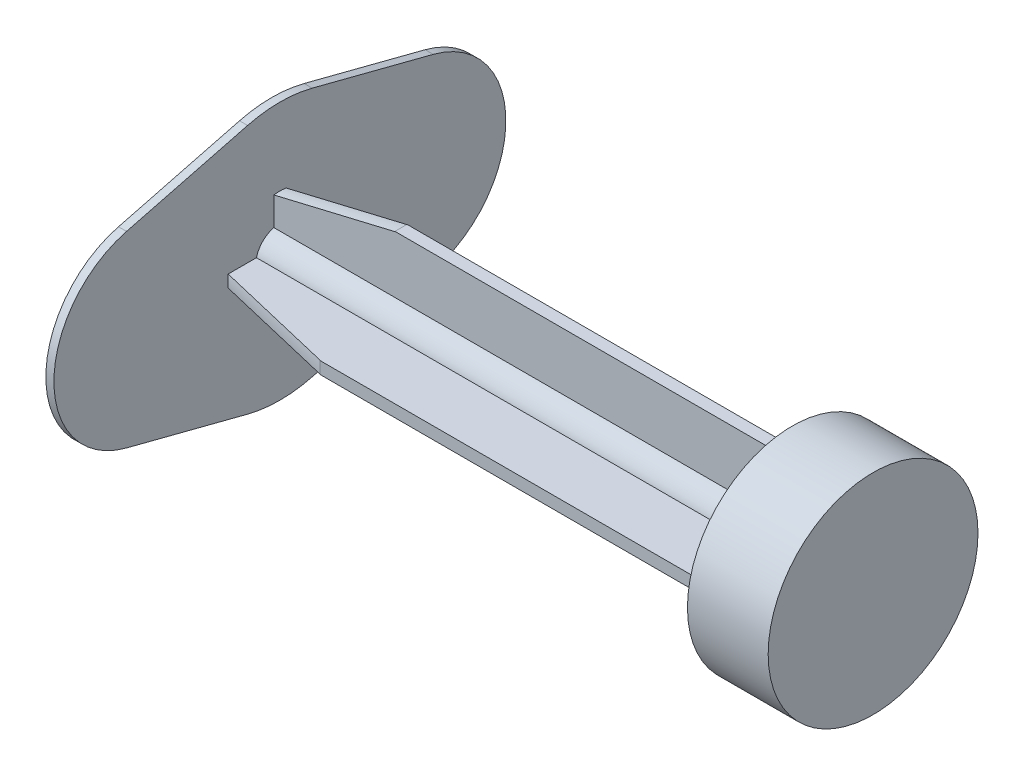
from build123d import *

# Parameters (mm, degrees)
BOSS_EXTRUDE1_DEPTH      = 90
FILLET1_R                = 7.5
FILLET2_R                = 2
SKETCH2_W                = 20
SKETCH2_H                = 80
SKETCH2_W_2              = 32
BOSS_EXTRUDE2_DEPTH      = 20
SKETCH3_R                = 2.5
BOSS_EXTRUDE3_DEPTH      = 111
BOSS_EXTRUDE4_START      = 7.5
SKETCH4_W                = 80
SKETCH4_H                = 20
SKETCH4_R                = 3.25
BOSS_EXTRUDE4_DEPTH      = 20
MOVE_FACE1_BY            = 1.5
MOVE_FACE2_BY            = 1.5
FILLET3_R                = 4
FILLET4_R                = 4
CUT_EXTRUDE1_DEPTH       = 2
BOSS_EXTRUDE5_DEPTH      = 2
SKETCH7_W                = 58
SKETCH7_H                = 15
CUT_EXTRUDE2_DEPTH       = 0.5
SKETCH8_R                = 10
BOSS_EXTRUDE6_DEPTH      = 1.5
SKETCH10_R               = 4.25
SKETCH10_R_2             = 2.75
CUT_EXTRUDE_THIN1_DEPTH  = 1.5
SKETCH11_RX              = 5
SKETCH11_RY              = 2.5
BOSS_EXTRUDE7_DEPTH      = 1.5
LPATTERN1_COUNT          = 3
LPATTERN1_PITCH          = 24
SKETCH12_RX              = 5
SKETCH12_RY              = 2.5
BOSS_EXTRUDE8_DEPTH      = 1.5
LPATTERN2_START          = 113.13708499
LPATTERN2_DEPTH          = 1.5
FILLET7_R                = 7.5
FILLET5_R                = 5
FILLET6_R                = 2
SHELL1_T                 = -1
SKETCH14_R               = 14
BOSS_EXTRUDE9_DEPTH      = 1
BOSS_EXTRUDE10_DEPTH     = 1
BOSS_EXTRUDE11_START     = -30
BOSS_EXTRUDE11_OUTLINE_R = 13
BOSS_EXTRUDE11_DEPTH     = 10
BOSS_EXTRUDE12_REACH     = 233.484
SKETCH18_R               = 3
SKETCH17_W               = 1.5
SKETCH17_H               = 20
SKETCH17_W_2             = 20
SKETCH17_H_2             = 1.5
EXTRUDE_THIN1_DEPTH      = 63.5
SKETCH20_R               = 12.5
BOSS_EXTRUDE13_DEPTH     = 5
FILLET8_R                = 2


# Read off the part's stored shape, not the designer's step: LPattern2, Body-Move/Copy1, Boss-Extrude11
with BuildPart() as part:
    # Sketch1 → Boss-Extrude1 (new, symmetric)
    with BuildSketch(Plane(origin=(0, 0, 0), x_dir=(0, 0, -1), z_dir=(1, 0, 0))):
        Polygon((0, 0), (0, 45), (-115, 45), (-160, 0), align=None)
    extrude(amount=BOSS_EXTRUDE1_DEPTH, both=True)

    # Fillet1
    fillet1_edges = [part.edges().sort_by_distance(p)[0] for p in [
        (0, 0, 160),
        (0, 45, 115),
        (0, 45, 0),
        (0, 0, 0),
    ]]
    fillet(fillet1_edges, radius=FILLET1_R)

    # Fillet2
    fillet2_edges = [part.edges().sort_by_distance(p)[0] for p in [
        (-90, 0, 74.696699141),
        (90, 0, 74.696699141),
        (-90, 27.803300859, 132.196699141),
        (-90, 45, 59.696699141),
        (-90, 22.5, 0),
        (-90, 44.429096494, 114.763524025),
        (-90, 2.196699141, 2.196699141),
        (-90, 42.803300859, 2.196699141),
        (-90, 4.629874257, 148.822494776),
        (90, 27.803300859, 132.196699141),
        (90, 22.5, 0),
        (90, 45, 59.696699141),
        (90, 44.429096494, 114.763524025),
        (90, 2.196699141, 2.196699141),
        (90, 42.803300859, 2.196699141),
        (90, 4.629874257, 148.822494776),
    ]]
    fillet(fillet2_edges, radius=FILLET2_R)

    # Sketch2 → Boss-Extrude2 (add)
    with BuildSketch(Plane(origin=(0, 45, 0), x_dir=(1, 0, 0), z_dir=(0, 1, 0))):
        with Locations((-71.5, -59.696699141)):
            Rectangle(SKETCH2_W, SKETCH2_H)
        with Locations((65.5, -59.696699141)):
            Rectangle(SKETCH2_W_2, SKETCH2_H)
    extrude(amount=BOSS_EXTRUDE2_DEPTH)

    # Sketch3 → Boss-Extrude3 (add)
    with BuildSketch(Plane(origin=(-61.5, 0, 0), x_dir=(0, 0, -1), z_dir=(1, 0, 0))):
        with Locations(Location((-89.696699141, 59.5, 0), (0, 0, 180))):
            Circle(SKETCH3_R)
        with Locations(Location((-89.696699141, 50.5, 0), (0, 0, 180))):
            Circle(SKETCH3_R)
        with Locations(Location((-29.696699141, 50.5, 0), (0, 0, 180))):
            Circle(SKETCH3_R)
        with Locations(Location((-29.696699141, 59.5, 0), (0, 0, 180))):
            Circle(SKETCH3_R)
    extrude(amount=BOSS_EXTRUDE3_DEPTH)

    # Fillet3
    fillet3_edges = [part.edges().sort_by_distance(p)[0] for p in [
        (65.5, 65, 99.696699141),
        (65.5, 65, 19.696699141),
        (-71.5, 65, 99.696699141),
        (-71.5, 65, 19.696699141),
    ]]
    fillet(fillet3_edges, radius=FILLET3_R)

    # Sketch5 → Cut-Extrude1 (cut)
    with BuildSketch(Plane(origin=(0, 80, 80), x_dir=(1, 0, 0), z_dir=(0, 0.7071067811865511, 0.707106781186544))):
        with BuildLine():
            Line((-65, -56.317279836), (65, -56.317279836))
            ThreePointArc((65, -56.317279836), (66.767766953, -57.049512883), (67.5, -58.817279836))
            Line((67.5, -58.817279836), (67.5, -88.817279836))
            ThreePointArc((67.5, -88.817279836), (66.767766953, -90.585046789), (65, -91.317279836))
            Line((65, -91.317279836), (-65, -91.317279836))
            ThreePointArc((-65, -91.317279836), (-66.767766953, -90.585046789), (-67.5, -88.817279836))
            Line((-67.5, -88.817279836), (-67.5, -58.817279836))
            ThreePointArc((-67.5, -58.817279836), (-66.767766953, -57.049512883), (-65, -56.317279836))
        make_face()
    extrude(amount=-CUT_EXTRUDE1_DEPTH, mode=Mode.SUBTRACT)


with BuildPart() as body_2:
    # Sketch4 → Boss-Extrude4 (new body)
    with BuildSketch(Plane(origin=(-61.5, 0, 0), x_dir=(0, 0, -1), z_dir=(1, 0, 0)).offset(BOSS_EXTRUDE4_START)):
        with Locations((-59.696699141, 55)):
            Rectangle(SKETCH4_W, SKETCH4_H)
        with Locations((-89.696699141, 59.5)):
            Circle(SKETCH4_R, mode=Mode.SUBTRACT)
        with Locations((-89.696699141, 50.5)):
            Circle(SKETCH4_R, mode=Mode.SUBTRACT)
        with Locations((-29.696699141, 59.5)):
            Circle(SKETCH4_R, mode=Mode.SUBTRACT)
        with Locations((-29.696699141, 50.5)):
            Circle(SKETCH4_R, mode=Mode.SUBTRACT)
    extrude(amount=BOSS_EXTRUDE4_DEPTH)

    # Move Face1: a face moved outward by 1.5
    extrude(body_2.faces().sort_by_distance((-44, 65, 59.696699141))[0], amount=MOVE_FACE1_BY, dir=(0, 1, 0))

    # Move Face2: a face moved inward by 1.5
    extrude(body_2.faces().sort_by_distance((-44, 45, 59.696699141))[0], amount=MOVE_FACE2_BY, dir=(0, 1, 0), mode=Mode.SUBTRACT)

    # Fillet4
    fillet4_edges = [body_2.edges().sort_by_distance(p)[0] for p in [
        (-44, 66.5, 99.696699141),
        (-44, 66.5, 19.696699141),
        (-44, 46.5, 19.696699141),
        (-44, 46.5, 99.696699141),
    ]]
    fillet(fillet4_edges, radius=FILLET4_R)


with BuildPart() as body_3:
    # Sketch6 → Boss-Extrude5 (new body)
    with BuildSketch(Plane(origin=(0, 78.585786438, 78.585786438), x_dir=(1, 0, 0), z_dir=(0, 0.7071067811865509, 0.7071067811865441))):
        with BuildLine():
            Line((65, -56.317279836), (-65, -56.317279836))
            ThreePointArc((-65, -56.317279836), (-66.767766953, -57.049512883), (-67.5, -58.817279836))
            Line((-67.5, -58.817279836), (-67.5, -88.817279836))
            ThreePointArc((-67.5, -88.817279836), (-66.767766953, -90.585046789), (-65, -91.317279836))
            Line((-65, -91.317279836), (65, -91.317279836))
            ThreePointArc((65, -91.317279836), (66.767766953, -90.585046789), (67.5, -88.817279836))
            Line((67.5, -88.817279836), (67.5, -58.817279836))
            ThreePointArc((67.5, -58.817279836), (66.767766953, -57.049512883), (65, -56.317279836))
        make_face()
    extrude(amount=BOSS_EXTRUDE5_DEPTH)

    # Sketch7 → Cut-Extrude2 (cut)
    with BuildSketch(Plane(origin=(0, 80, 80), x_dir=(1, 0, 0), z_dir=(0, 0.7071067811865509, 0.7071067811865441))):
        with Locations((-28.5, -71.817279836)):
            Rectangle(SKETCH7_W, SKETCH7_H)
    extrude(amount=-CUT_EXTRUDE2_DEPTH, mode=Mode.SUBTRACT)

    # Sketch8 → Boss-Extrude6 (add)
    with BuildSketch(Plane(origin=(0, 80, 80), x_dir=(1, 0, 0), z_dir=(0, 0.7071067811865509, 0.7071067811865441))):
        with Locations(Location((15.5, -71.817279836, 0), (0, 0, 270))):
            Circle(SKETCH8_R)
    extrude(amount=BOSS_EXTRUDE6_DEPTH)

    # Sketch10 → Cut-Extrude-Thin1 (cut)
    # profile 1 of 5: a face of its own
    with BuildSketch(Plane(origin=(0, 81.060660172, 81.060660172), x_dir=(1, 0, 0), z_dir=(0, 0.7071067811865509, 0.7071067811865441))):
        with Locations((15.5, -71.817279836)):
            Circle(SKETCH10_R)
        with Locations((15.5, -71.817279836)):
            Circle(SKETCH10_R_2, mode=Mode.SUBTRACT)
    # profile 2 of 5: a face of its own
    with BuildSketch(Plane(origin=(0, 81.060660172, 81.060660172), x_dir=(1, 0, 0), z_dir=(0, 0.7071067811865509, 0.7071067811865441))):
        Polygon((7.898602102, -65.27654211), (12.49479618, -69.872736188), (13.555456352, -68.812076016), (8.959262274, -64.215881939), align=None)
    # profile 3 of 5: a face of its own
    with BuildSketch(Plane(origin=(0, 81.060660172, 81.060660172), x_dir=(1, 0, 0), z_dir=(0, 0.7071067811865509, 0.7071067811865441))):
        Polygon((22.040737726, -64.215881939), (17.444543648, -68.812076016), (18.50520382, -69.872736188), (23.101397898, -65.27654211), align=None)
    # profile 4 of 5: a face of its own
    with BuildSketch(Plane(origin=(0, 81.060660172, 81.060660172), x_dir=(1, 0, 0), z_dir=(0, 0.7071067811865509, 0.7071067811865441))):
        Polygon((17.444543648, -74.822483656), (22.040737726, -79.418677734), (23.101397898, -78.358017562), (18.50520382, -73.761823485), align=None)
    # profile 5 of 5: a face of its own
    with BuildSketch(Plane(origin=(0, 81.060660172, 81.060660172), x_dir=(1, 0, 0), z_dir=(0, 0.7071067811865509, 0.7071067811865441))):
        Polygon((12.49479618, -73.761823485), (7.898602102, -78.358017562), (8.959262274, -79.418677734), (13.555456352, -74.822483656), align=None)
    extrude(amount=-CUT_EXTRUDE_THIN1_DEPTH, mode=Mode.SUBTRACT)

    # Sketch11 → Boss-Extrude7 (add)
    with BuildSketch(Plane(origin=(0, 80, 80), x_dir=(1, 0, 0), z_dir=(0, 0.7071067811865509, 0.7071067811865441))):
        with Locations((-52.5, -85.317279836)):
            Ellipse(SKETCH11_RX, SKETCH11_RY)
    boss_extrude7 = extrude(amount=BOSS_EXTRUDE7_DEPTH)

    # LPattern1: Boss-Extrude7 ×3
    with Locations(*[(i * LPATTERN1_PITCH, 0, 0) for i in range(1, LPATTERN1_COUNT)]):
        add(boss_extrude7)

    # Sketch12 → Boss-Extrude8 (add)
    with BuildSketch(Plane(origin=(0, 80, 80), x_dir=(1, 0, 0), z_dir=(0, 0.7071067811865509, 0.7071067811865441))):
        with Locations((32.5, -66.317279836)):
            Ellipse(SKETCH12_RX, SKETCH12_RY)
    extrude(amount=BOSS_EXTRUDE8_DEPTH)

    # LPattern2 outline → LPattern2 (add)
    with BuildSketch(Plane(origin=(0, 0, 0), x_dir=(1, 0, 0), z_dir=(0, 0.707106781186551, 0.7071067811865439)).offset(LPATTERN2_START)):
        with BuildLine():
            add(Edge.make_bspline(
                [(37.5, -74.317279836), (37.5, -69.987152818), (30, -72.152216327), (22.5, -74.317279836), (30, -76.482343346), (37.5, -78.647406855), (37.5, -74.317279836)],
                knots=[0, 0, 0, 2.094395102, 2.094395102, 4.188790205, 4.188790205, 6.283185307, 6.283185307, 6.283185307], degree=2, weights=[1, 0.5, 1, 0.5, 1, 0.5, 1]))
        make_face()
        with BuildLine():
            add(Edge.make_bspline(
                [(37.5, -82.317279836), (37.5, -77.987152818), (30, -80.152216327), (22.5, -82.317279836), (30, -84.482343346), (37.5, -86.647406855), (37.5, -82.317279836)],
                knots=[0, 0, 0, 2.094395102, 2.094395102, 4.188790205, 4.188790205, 6.283185307, 6.283185307, 6.283185307], degree=2, weights=[1, 0.5, 1, 0.5, 1, 0.5, 1]))
        make_face()
        with BuildLine():
            add(Edge.make_bspline(
                [(49.5, -66.317279836), (49.5, -61.987152818), (42, -64.152216327), (34.5, -66.317279836), (42, -68.482343346), (49.5, -70.647406855), (49.5, -66.317279836)],
                knots=[0, 0, 0, 2.094395102, 2.094395102, 4.188790205, 4.188790205, 6.283185307, 6.283185307, 6.283185307], degree=2, weights=[1, 0.5, 1, 0.5, 1, 0.5, 1]))
        make_face()
        with BuildLine():
            add(Edge.make_bspline(
                [(49.5, -74.317279836), (49.5, -69.987152818), (42, -72.152216327), (34.5, -74.317279836), (42, -76.482343346), (49.5, -78.647406855), (49.5, -74.317279836)],
                knots=[0, 0, 0, 2.094395102, 2.094395102, 4.188790205, 4.188790205, 6.283185307, 6.283185307, 6.283185307], degree=2, weights=[1, 0.5, 1, 0.5, 1, 0.5, 1]))
        make_face()
        with BuildLine():
            add(Edge.make_bspline(
                [(49.5, -82.317279836), (49.5, -77.987152818), (42, -80.152216327), (34.5, -82.317279836), (42, -84.482343346), (49.5, -86.647406855), (49.5, -82.317279836)],
                knots=[0, 0, 0, 2.094395102, 2.094395102, 4.188790205, 4.188790205, 6.283185307, 6.283185307, 6.283185307], degree=2, weights=[1, 0.5, 1, 0.5, 1, 0.5, 1]))
        make_face()
        with BuildLine():
            add(Edge.make_bspline(
                [(61.5, -66.317279836), (61.5, -61.987152818), (54, -64.152216327), (46.5, -66.317279836), (54, -68.482343346), (61.5, -70.647406855), (61.5, -66.317279836)],
                knots=[0, 0, 0, 2.094395102, 2.094395102, 4.188790205, 4.188790205, 6.283185307, 6.283185307, 6.283185307], degree=2, weights=[1, 0.5, 1, 0.5, 1, 0.5, 1]))
        make_face()
        with BuildLine():
            add(Edge.make_bspline(
                [(61.5, -74.317279836), (61.5, -69.987152818), (54, -72.152216327), (46.5, -74.317279836), (54, -76.482343346), (61.5, -78.647406855), (61.5, -74.317279836)],
                knots=[0, 0, 0, 2.094395102, 2.094395102, 4.188790205, 4.188790205, 6.283185307, 6.283185307, 6.283185307], degree=2, weights=[1, 0.5, 1, 0.5, 1, 0.5, 1]))
        make_face()
        with BuildLine():
            add(Edge.make_bspline(
                [(61.5, -82.317279836), (61.5, -77.987152818), (54, -80.152216327), (46.5, -82.317279836), (54, -84.482343346), (61.5, -86.647406855), (61.5, -82.317279836)],
                knots=[0, 0, 0, 2.094395102, 2.094395102, 4.188790205, 4.188790205, 6.283185307, 6.283185307, 6.283185307], degree=2, weights=[1, 0.5, 1, 0.5, 1, 0.5, 1]))
        make_face()
    extrude(amount=LPATTERN2_DEPTH)


with BuildPart() as body_4:
    # Sketch13 → Revolve1 (revolve)
    with BuildSketch(Plane.XY.offset(59.696699141), mode=Mode.PRIVATE) as revolve1_sk:
        Polygon((11.5, 70), (11.5, 85), (105.301145933, 85), (111.5, 74.263269807), (121.5, 72.5), (121.5, 70), align=None)
    revolve(revolve1_sk.sketch.rotate(Axis((11.5, 70, 59.696699141), (1, 0, 0)), 90), axis=Axis((11.5, 70, 59.696699141), (1, 0, 0)))

    # Fillet5
    fillet5_edges = [body_4.edges().sort_by_distance(p)[0] for p in [
        (105.301145933, 70, 44.696699141),
    ]]
    fillet(fillet5_edges, radius=FILLET5_R)

    # Fillet6
    fillet6_edges = [body_4.edges().sort_by_distance(p)[0] for p in [
        (111.5, 70, 55.433429334),
    ]]
    fillet(fillet6_edges, radius=FILLET6_R)

    # Shell1
    shell1_openings = [body_4.faces().sort_by_distance(p)[0] for p in [
        (121.5, 70, 59.696699141),
        (11.5, 70, 59.696699141),
    ]]
    offset(amount=SHELL1_T, openings=shell1_openings, kind=Kind.INTERSECTION)

    # Sketch14 → Boss-Extrude9 (add)
    with BuildSketch(Plane.ZY.offset(-11.5)):
        with BuildLine():
            Line((55.696699141, 85.491933385), (40.696699141, 81.618950039))
            ThreePointArc((40.696699141, 81.618950039), (31.696699141, 70), (40.696699141, 58.381049961))
            Line((40.696699141, 58.381049961), (55.696699141, 54.508066615))
            ThreePointArc((55.696699141, 54.508066615), (59.696699141, 54), (63.696699141, 54.508066615))
            Line((63.696699141, 54.508066615), (78.696699141, 58.381049961))
            ThreePointArc((78.696699141, 58.381049961), (87.696699141, 70), (78.696699141, 81.618950039))
            Line((78.696699141, 81.618950039), (63.696699141, 85.491933385))
            ThreePointArc((63.696699141, 85.491933385), (59.696699141, 86), (55.696699141, 85.491933385))
        make_face()
        with Locations((59.696699141, 70)):
            Circle(SKETCH14_R, mode=Mode.SUBTRACT)
    extrude(amount=BOSS_EXTRUDE9_DEPTH)


with BuildPart() as body_5:
    # Body-Move/Copy1 outline → Body-Move/Copy1 (revolve)
    with BuildSketch(Plane(origin=(0, 70, 59.696699141), x_dir=(0, 1, 0), z_dir=(0, 0, -1))):
        Polygon((0, 121.5), (0, 11.5), (15, 11.5), (15, 105.301145933), (4.263269807, 111.5), (2.5, 121.5), align=None)
    revolve(axis=Axis((0, 70, 59.696699141), (1, 0, 0)))


with BuildPart() as part_1:
    add(part.part)

    # Combine1: cut body 5
    add(body_5.part, mode=Mode.SUBTRACT)

    # Fillet7
    fillet7_edges = [part_1.edges().sort_by_distance(p)[0] for p in [
        (65.5, 65, 73.838834765),
        (65.5, 65, 45.554563517),
    ]]
    fillet(fillet7_edges, radius=FILLET7_R)

    # Sketch20 → Boss-Extrude13 (add)
    with BuildSketch(Plane.XZ):
        with Locations(Location((-60, 116.893398282, 0), (0, 0, 90))):
            Circle(SKETCH20_R)
        with Locations(Location((-60, 32.5, 0), (0, 0, 90))):
            Circle(SKETCH20_R)
        with Locations(Location((60, 32.5, 0), (0, 0, 90))):
            Circle(SKETCH20_R)
        with Locations(Location((60, 116.893398282, 0), (0, 0, 90))):
            Circle(SKETCH20_R)
    extrude(amount=BOSS_EXTRUDE13_DEPTH)

    # Fillet8
    fillet8_edges = [part_1.edges().sort_by_distance(p)[0] for p in [
        (-60, -5, 104.393398282),
        (-60, -5, 20),
        (60, -5, 20),
        (60, -5, 104.393398282),
    ]]
    fillet(fillet8_edges, radius=FILLET8_R)


with BuildPart() as body_5_2:
    # Sketch15 → Boss-Extrude10 (new body)
    with BuildSketch(Plane(origin=(-34, 0, 0), x_dir=(0, 0, -1), z_dir=(1, 0, 0))):
        with BuildLine():
            Line((-63.696699141, 85.491933385), (-78.696699141, 81.618950039))
            ThreePointArc((-78.696699141, 81.618950039), (-87.696699141, 70), (-78.696699141, 58.381049961))
            Line((-78.696699141, 58.381049961), (-63.696699141, 54.508066615))
            ThreePointArc((-63.696699141, 54.508066615), (-59.696699141, 54), (-55.696699141, 54.508066615))
            Line((-55.696699141, 54.508066615), (-40.696699141, 58.381049961))
            ThreePointArc((-40.696699141, 58.381049961), (-31.696699141, 70), (-40.696699141, 81.618950039))
            Line((-40.696699141, 81.618950039), (-55.696699141, 85.491933385))
            ThreePointArc((-55.696699141, 85.491933385), (-59.696699141, 86), (-63.696699141, 85.491933385))
        make_face()
    extrude(amount=BOSS_EXTRUDE10_DEPTH)


with BuildPart() as body_6:
    # Boss-Extrude11 outline → Boss-Extrude11 (new body)
    with BuildSketch(Plane.ZY.offset(-10.5).offset(BOSS_EXTRUDE11_START)):
        with Locations((59.696699141, 70)):
            Circle(BOSS_EXTRUDE11_OUTLINE_R)
    extrude(amount=BOSS_EXTRUDE11_DEPTH)

    # Sketch18 → Boss-Extrude12 (add, up to next)
    with BuildSketch(Plane(origin=(-33, 0, 0), x_dir=(0, 0, -1), z_dir=(1, 0, 0)), mode=Mode.PRIVATE) as boss_extrude12_sk1:
        with Locations(Location((-59.696699141, 70, 0), (0, 0, 180))):
            Circle(SKETCH18_R)
    boss_extrude12_tool1 = extrude(boss_extrude12_sk1.sketch, amount=BOSS_EXTRUDE12_REACH, mode=Mode.PRIVATE) - body_6.part

    add(body_5_2.part)  # Boss-Extrude12 merges body 5 2
    add(boss_extrude12_tool1.solids().sort_by_distance((-33, 70, 59.696699))[0])

    # Sketch17 → Extrude-Thin1 (add)
    with BuildSketch(Plane(origin=(-33, 0, 0), x_dir=(0, 0, -1), z_dir=(1, 0, 0))):
        with Locations((-59.696699141, 70)):
            Rectangle(SKETCH17_W, SKETCH17_H)
        with Locations((-59.696699141, 70)):
            Rectangle(SKETCH17_W_2, SKETCH17_H_2)
    extrude(amount=EXTRUDE_THIN1_DEPTH)

    # Sketch19 → Cut-Revolve3 (revolve, cut)
    with BuildSketch(Plane.XY.offset(59.696699141), mode=Mode.PRIVATE) as cut_revolve3_sk:
        Polygon((-33, 76.452368755), (-18, 80), (-18, 81.618950039), (-33, 81.618950039), align=None)
    revolve(cut_revolve3_sk.sketch.rotate(Axis((111.5, 70, 59.696699141), (-1, 0, 0)), 270), axis=Axis((111.5, 70, 59.696699141), (-1, 0, 0)), mode=Mode.SUBTRACT)


solid = body_6.part
